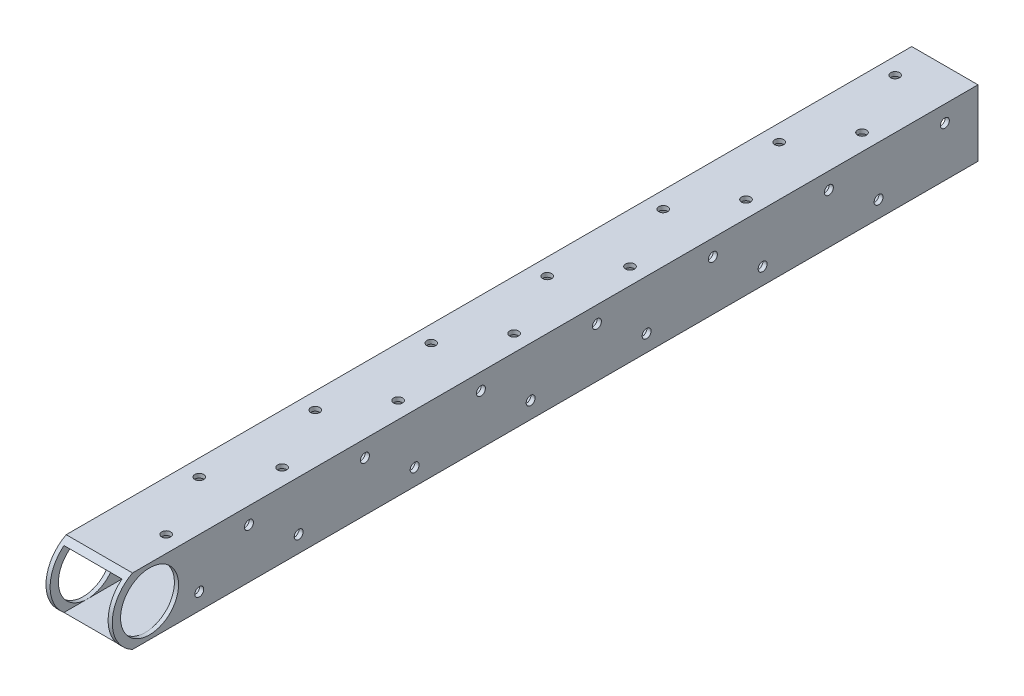
from build123d import *

# Parameters (mm, degrees)
SKETCH1_W                        = 25.4
SKETCH1_H                        = 25.4
SKETCH1_W_2                      = 22.225
SKETCH1_H_2                      = 22.225
EXTRUDE_THIN1_DEPTH              = 168.275
SKETCH2_R                        = 11.1125
CUT_EXTRUDE1_DEPTH               = 171.65440406
CUT_EXTRUDE2_DEPTH               = 171.65440406
F_1_8_0_135_DIAMETER_HOLE1_D     = 3.429
F_1_8_0_135_DIAMETER_HOLE1_DEPTH = 16.51
F_1_8_0_135_DIAMETER_HOLE1_TIP   = 1.030175531
F_1_8_0_135_DIAMETER_HOLE4_D     = 3.429
F_1_8_0_135_DIAMETER_HOLE4_DEPTH = 3.429
F_1_8_0_135_DIAMETER_HOLE4_TIP   = 1.030175531


with BuildPart() as part:
    # Sketch1 → Extrude-Thin1 (new, symmetric)
    with BuildSketch(Plane.XY):
        Rectangle(SKETCH1_W, SKETCH1_H)
        Rectangle(SKETCH1_W_2, SKETCH1_H_2, mode=Mode.SUBTRACT)
    extrude(amount=EXTRUDE_THIN1_DEPTH, both=True)

    # Sketch2 → Cut-Extrude1 (cut, through all)
    with BuildSketch(Plane(origin=(12.7, 0, 0), x_dir=(0, 0, -1), z_dir=(1, 0, 0))):
        with Locations((-149.225, 0)):
            Circle(SKETCH2_R)
    extrude(amount=-CUT_EXTRUDE1_DEPTH, mode=Mode.SUBTRACT)

    # Sketch3 → Cut-Extrude2 (cut, through all)
    with BuildSketch(Plane(origin=(12.7, 0, 0), x_dir=(0, 0, -1), z_dir=(1, 0, 0))):
        with BuildLine():
            Line((-149.225, 14.2875), (-168.275, 14.2875))
            Line((-168.275, 14.2875), (-168.275, -12.7))
            Line((-168.275, -12.7), (-155.770430181, -12.7))
            ThreePointArc((-155.770430181, -12.7), (-163.1099542, 3.367596045), (-149.225, 14.2875))
        make_face()
    extrude(amount=-CUT_EXTRUDE2_DEPTH, mode=Mode.SUBTRACT)

    # 1/8 (0.135) Diameter Hole1
    with Locations(Plane(origin=(12.7, 0, 0), x_dir=(0, 0, -1), z_dir=(1, 0, 0))):
        with Locations((-111.125, 6.35), (-92.075, -6.35), (-66.675, 6.35), (-47.625, -6.35), (-22.225, 6.35), (-3.175, -6.35), (22.225, 6.35), (41.275, -6.35), (66.675, 6.35), (85.725, -6.35), (111.125, 6.35), (130.175, -6.35), (155.575, 6.35), (-130.175, -6.35)):
            Hole(F_1_8_0_135_DIAMETER_HOLE1_D / 2, depth=F_1_8_0_135_DIAMETER_HOLE1_DEPTH)
            with Locations((0, 0, -(F_1_8_0_135_DIAMETER_HOLE1_DEPTH + F_1_8_0_135_DIAMETER_HOLE1_TIP / 2))):  # 118° drill point
                Cone(0, F_1_8_0_135_DIAMETER_HOLE1_D / 2, F_1_8_0_135_DIAMETER_HOLE1_TIP, mode=Mode.SUBTRACT)

    # 1/8 (0.135) Diameter Hole4
    with Locations(Plane(origin=(0, 12.7, 0), x_dir=(-1, 0, 0), z_dir=(0, 1, 0))):
        with Locations((-6.35, 136.525), (6.35, 111.125), (-6.35, 92.075), (6.35, 66.675), (-6.35, 47.625), (6.35, 22.225), (-6.35, 3.175), (6.35, -22.225), (-6.35, -41.275), (6.35, -66.675), (-6.35, -85.725), (6.35, -111.125), (-6.35, -130.175), (6.35, -155.575)):
            Hole(F_1_8_0_135_DIAMETER_HOLE4_D / 2, depth=F_1_8_0_135_DIAMETER_HOLE4_DEPTH)
            with Locations((0, 0, -(F_1_8_0_135_DIAMETER_HOLE4_DEPTH + F_1_8_0_135_DIAMETER_HOLE4_TIP / 2))):  # 118° drill point
                Cone(0, F_1_8_0_135_DIAMETER_HOLE4_D / 2, F_1_8_0_135_DIAMETER_HOLE4_TIP, mode=Mode.SUBTRACT)


solid = part.part
